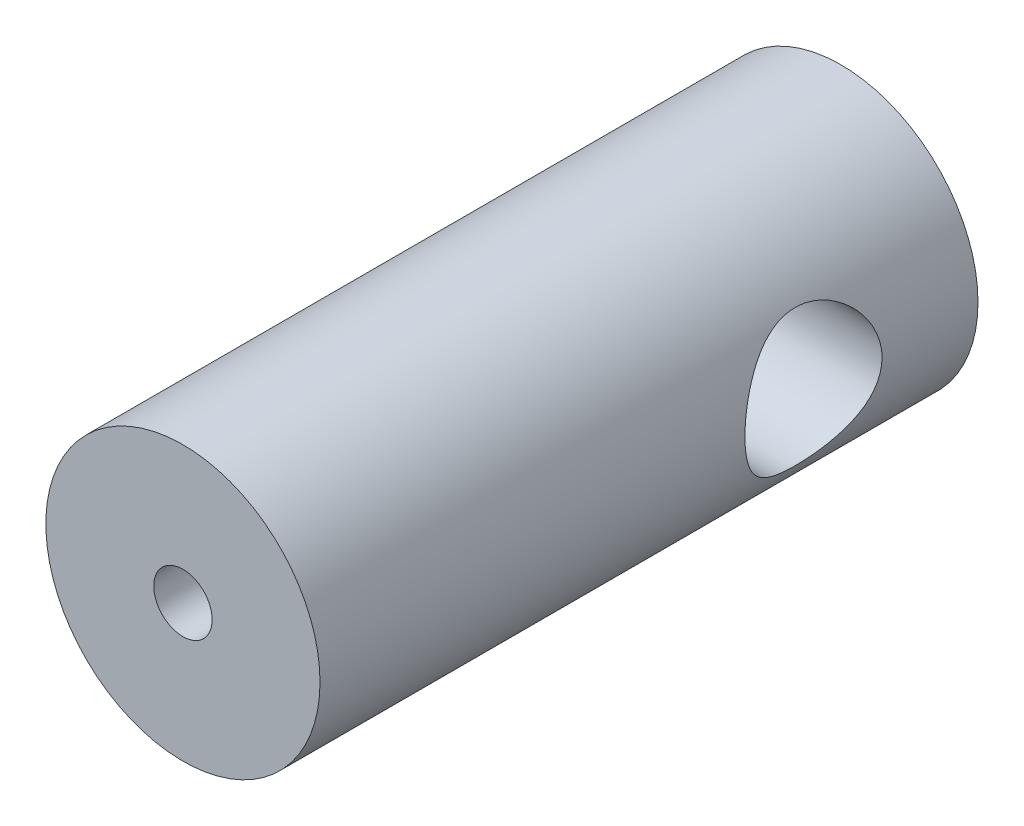
from build123d import *

# Parameters (mm, degrees)
SKETCH1_R                 = 6.35
BOSS_EXTRUDE1_DEPTH       = 30.48
CUT_EXTRUDE2_DEPTH        = 32.775389848
CUT_EXTRUDE2_DEPTH_BACK   = 32.775389848
SKETCH3_R                 = 3.175
F_6_32_TAPPED_HOLE1_D     = 2.7051
F_6_32_TAPPED_HOLE1_DEPTH = 12.7
F_6_32_TAPPED_HOLE1_TIP   = 0.81269403


with BuildPart() as part:
    # Sketch1 → Boss-Extrude1 (new body)
    with BuildSketch(Plane.XY):
        Circle(SKETCH1_R)
    extrude(amount=BOSS_EXTRUDE1_DEPTH)

    # Sketch3 → Cut-Extrude2 (cut, two sides: drawn at the far end of the back side and taken through both)
    with BuildSketch(Plane(origin=(0, 0, 0), x_dir=(0, 0, -1), z_dir=(1, 0, 0)).offset(-CUT_EXTRUDE2_DEPTH_BACK)):
        with Locations((-7.62, 0)):
            Circle(SKETCH3_R)
    extrude(amount=CUT_EXTRUDE2_DEPTH + CUT_EXTRUDE2_DEPTH_BACK, mode=Mode.SUBTRACT)

    # #6-32 Tapped Hole1
    with Locations(Plane.XY.offset(30.48)):
        with Locations((0, 0)):
            Hole(F_6_32_TAPPED_HOLE1_D / 2, depth=F_6_32_TAPPED_HOLE1_DEPTH)
            with Locations((0, 0, -(F_6_32_TAPPED_HOLE1_DEPTH + F_6_32_TAPPED_HOLE1_TIP / 2))):  # 118° drill point
                Cone(0, F_6_32_TAPPED_HOLE1_D / 2, F_6_32_TAPPED_HOLE1_TIP, mode=Mode.SUBTRACT)


solid = part.part
